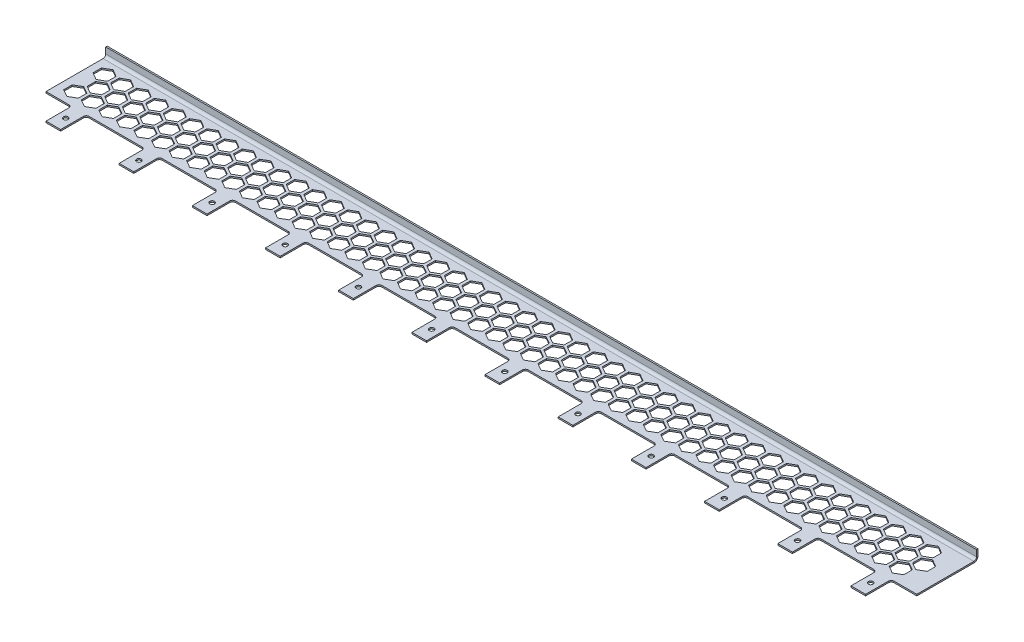
from build123d import *

# Parameters (mm, degrees)
SKETCH1_R          = 1.6
BASE_FLANGE2_DEPTH = 1
EDGE_FLANGE1_DEPTH = 595
CUT_EXTRUDE2_DEPTH = 597.496638716


# Sheet-metal steps are written as plain solids
with BuildPart() as part:
    # Sketch1 → Base-Flange2 (new body)
    with BuildSketch(Plane(origin=(0, 0, 0), x_dir=(1, 0, 0), z_dir=(0, 1, 0))):
        with BuildLine():
            Line((29.5, 0), (65.5, 0))
            ThreePointArc((65.5, 0), (66.914213562, -0.585786438), (67.5, -2))
            Line((67.5, -2), (67.5, -17.5))
            Line((67.5, -17.5), (77.5, -17.5))
            Line((77.5, -17.5), (77.5, -2))
            ThreePointArc((77.5, -2), (78.085786438, -0.585786438), (79.5, 0))
            Line((79.5, 0), (115.5, 0))
            ThreePointArc((115.5, 0), (116.914213562, -0.585786438), (117.5, -2))
            Line((117.5, -2), (117.5, -17.5))
            Line((117.5, -17.5), (127.5, -17.5))
            Line((127.5, -17.5), (127.5, -2))
            ThreePointArc((127.5, -2), (128.085786438, -0.585786438), (129.5, 0))
            Line((129.5, 0), (165.5, 0))
            ThreePointArc((165.5, 0), (166.914213562, -0.585786438), (167.5, -2))
            Line((167.5, -2), (167.5, -17.5))
            Line((167.5, -17.5), (177.5, -17.5))
            Line((177.5, -17.5), (177.5, -2))
            ThreePointArc((177.5, -2), (178.085786438, -0.585786438), (179.5, 0))
            Line((179.5, 0), (215.5, 0))
            ThreePointArc((215.5, 0), (216.914213562, -0.585786438), (217.5, -2))
            Line((217.5, -2), (217.5, -17.5))
            Line((217.5, -17.5), (227.5, -17.5))
            Line((227.5, -17.5), (227.5, -2))
            ThreePointArc((227.5, -2), (228.085786438, -0.585786438), (229.5, 0))
            Line((229.5, 0), (265.5, 0))
            ThreePointArc((265.5, 0), (266.914213562, -0.585786438), (267.5, -2))
            Line((267.5, -2), (267.5, -17.5))
            Line((267.5, -17.5), (277.5, -17.5))
            Line((277.5, -17.5), (277.5, -2))
            ThreePointArc((277.5, -2), (278.085786438, -0.585786438), (279.5, 0))
            Line((279.5, 0), (315.5, 0))
            ThreePointArc((315.5, 0), (316.914213562, -0.585786438), (317.5, -2))
            Line((317.5, -2), (317.5, -17.5))
            Line((317.5, -17.5), (327.5, -17.5))
            Line((327.5, -17.5), (327.5, -2))
            ThreePointArc((327.5, -2), (328.085786438, -0.585786438), (329.5, 0))
            Line((329.5, 0), (365.5, 0))
            ThreePointArc((365.5, 0), (366.914213562, -0.585786438), (367.5, -2))
            Line((367.5, -2), (367.5, -17.5))
            Line((367.5, -17.5), (377.5, -17.5))
            Line((377.5, -17.5), (377.5, -2))
            ThreePointArc((377.5, -2), (378.085786438, -0.585786438), (379.5, 0))
            Line((379.5, 0), (415.5, 0))
            ThreePointArc((415.5, 0), (416.914213562, -0.585786438), (417.5, -2))
            Line((417.5, -2), (417.5, -17.5))
            Line((417.5, -17.5), (427.5, -17.5))
            Line((427.5, -17.5), (427.5, -2))
            ThreePointArc((427.5, -2), (428.085786438, -0.585786438), (429.5, 0))
            Line((429.5, 0), (465.5, 0))
            ThreePointArc((465.5, 0), (466.914213562, -0.585786438), (467.5, -2))
            Line((467.5, -2), (467.5, -17.5))
            Line((467.5, -17.5), (477.5, -17.5))
            Line((477.5, -17.5), (477.5, -2))
            ThreePointArc((477.5, -2), (478.085786438, -0.585786438), (479.5, 0))
            Line((479.5, 0), (515.5, 0))
            ThreePointArc((515.5, 0), (516.914213562, -0.585786438), (517.5, -2))
            Line((517.5, -2), (517.5, -17.5))
            Line((517.5, -17.5), (527.5, -17.5))
            Line((527.5, -17.5), (527.5, -2))
            ThreePointArc((527.5, -2), (528.085786438, -0.585786438), (529.5, 0))
            Line((529.5, 0), (565.5, 0))
            ThreePointArc((565.5, 0), (566.914213562, -0.585786438), (567.5, -2))
            Line((567.5, -2), (567.5, -17.5))
            Line((567.5, -17.5), (577.5, -17.5))
            Line((577.5, -17.5), (577.5, -2))
            ThreePointArc((577.5, -2), (578.085786438, -0.585786438), (579.5, 0))
            Line((579.5, 0), (595, 0))
            Line((595, 0), (595, 39))
            Line((595, 39), (0, 39))
            Line((0, 39), (0, 0))
            Line((0, 0), (15.5, 0))
            ThreePointArc((15.5, 0), (16.914213562, -0.585786438), (17.5, -2))
            Line((17.5, -2), (17.5, -17.5))
            Line((17.5, -17.5), (27.5, -17.5))
            Line((27.5, -17.5), (27.5, -2))
            ThreePointArc((27.5, -2), (28.085786438, -0.585786438), (29.5, 0))
        make_face()
        with Locations(Location((22.5, -9, 0), (0, 0, 270))):
            Circle(SKETCH1_R, mode=Mode.SUBTRACT)
        with Locations(Location((72.5, -9, 0), (0, 0, 270))):
            Circle(SKETCH1_R, mode=Mode.SUBTRACT)
        with Locations(Location((122.5, -9, 0), (0, 0, 270))):
            Circle(SKETCH1_R, mode=Mode.SUBTRACT)
        with Locations(Location((172.5, -9, 0), (0, 0, 270))):
            Circle(SKETCH1_R, mode=Mode.SUBTRACT)
        with Locations(Location((222.5, -9, 0), (0, 0, 270))):
            Circle(SKETCH1_R, mode=Mode.SUBTRACT)
        with Locations(Location((272.5, -9, 0), (0, 0, 270))):
            Circle(SKETCH1_R, mode=Mode.SUBTRACT)
        with Locations(Location((322.5, -9, 0), (0, 0, 270))):
            Circle(SKETCH1_R, mode=Mode.SUBTRACT)
        with Locations(Location((372.5, -9, 0), (0, 0, 270))):
            Circle(SKETCH1_R, mode=Mode.SUBTRACT)
        with Locations(Location((422.5, -9, 0), (0, 0, 270))):
            Circle(SKETCH1_R, mode=Mode.SUBTRACT)
        with Locations(Location((472.5, -9, 0), (0, 0, 270))):
            Circle(SKETCH1_R, mode=Mode.SUBTRACT)
        with Locations(Location((522.5, -9, 0), (0, 0, 270))):
            Circle(SKETCH1_R, mode=Mode.SUBTRACT)
        with Locations(Location((572.5, -9, 0), (0, 0, 270))):
            Circle(SKETCH1_R, mode=Mode.SUBTRACT)
    extrude(amount=-BASE_FLANGE2_DEPTH)

    # Edge-Flange1 section (across the edge) → Edge-Flange1 (add)
    with BuildSketch(Plane(origin=(595, 0, -40.8), x_dir=(0, 0, 1), z_dir=(-1, 0, 0))):
        with BuildLine():
            Line((-1, 1.8), (-1, 6))
            Line((-1, 6), (0, 6))
            Line((0, 6), (0, 1.8))
            ThreePointArc((0, 1.8), (0.527207794, 0.527207794), (1.8, 0))
            Line((1.8, 0), (1.8, -1))
            ThreePointArc((1.8, -1), (-0.179898987, -0.179898987), (-1, 1.8))
        make_face()
    extrude(amount=EDGE_FLANGE1_DEPTH)

    # Sketch15 → Cut-Extrude2 (cut, through all)
    with BuildSketch(Plane(origin=(0, 0, 0), x_dir=(1, 0, 0), z_dir=(0, 1, 0))):
        Polygon((10, 4.226497308), (15, 7.113248654), (15, 12.886751346), (10, 15.773502692), (5, 12.886751346), (5, 7.113248654), align=None)
        Polygon((21.937540227, 24.226836356), (26.968531093, 27.059231853), (27.031100072, 32.832395496), (22.062678186, 35.773163644), (17.031687321, 32.940768147), (16.969118341, 27.167604504), align=None)
        Polygon((15.982330318, 14.226524347), (20.991141743, 17.09795978), (21.008811424, 22.871435433), (16.017669682, 25.773475653), (11.008858257, 22.90204022), (10.991188576, 17.128564567), align=None)
        Polygon((9.937540227, 24.226836356), (14.968531093, 27.059231853), (15.031100072, 32.832395496), (10.062678186, 35.773163644), (5.031687321, 32.940768147), (4.969118341, 27.167604504), align=None)
        Polygon((27.982330318, 14.226524347), (32.991141743, 17.09795978), (33.008811424, 22.871435433), (28.017669682, 25.773475653), (23.008858257, 22.90204022), (22.991188576, 17.128564567), align=None)
        Polygon((22, 4.226497308), (27, 7.113248654), (27, 12.886751346), (22, 15.773502692), (17, 12.886751346), (17, 7.113248654), align=None)
        Polygon((33.937540227, 24.226836356), (38.968531093, 27.059231853), (39.031100072, 32.832395496), (34.062678186, 35.773163644), (29.031687321, 32.940768147), (28.969118341, 27.167604504), align=None)
        Polygon((39.982330318, 14.226524347), (44.991141743, 17.09795978), (45.008811424, 22.871435433), (40.017669682, 25.773475653), (35.008858257, 22.90204022), (34.991188576, 17.128564567), align=None)
        Polygon((34, 4.226497308), (39, 7.113248654), (39, 12.886751346), (34, 15.773502692), (29, 12.886751346), (29, 7.113248654), align=None)
        Polygon((45.937540227, 24.226836356), (50.968531093, 27.059231853), (51.031100072, 32.832395496), (46.062678186, 35.773163644), (41.031687321, 32.940768147), (40.969118341, 27.167604504), align=None)
        Polygon((51.982330318, 14.226524347), (56.991141743, 17.09795978), (57.008811424, 22.871435433), (52.017669682, 25.773475653), (47.008858257, 22.90204022), (46.991188576, 17.128564567), align=None)
        Polygon((46, 4.226497308), (51, 7.113248654), (51, 12.886751346), (46, 15.773502692), (41, 12.886751346), (41, 7.113248654), align=None)
        Polygon((57.937540227, 24.226836356), (62.968531093, 27.059231853), (63.031100072, 32.832395496), (58.062678186, 35.773163644), (53.031687321, 32.940768147), (52.969118341, 27.167604504), align=None)
        Polygon((63.982330318, 14.226524347), (68.991141743, 17.09795978), (69.008811424, 22.871435433), (64.017669682, 25.773475653), (59.008858257, 22.90204022), (58.991188576, 17.128564567), align=None)
        Polygon((58, 4.226497308), (63, 7.113248654), (63, 12.886751346), (58, 15.773502692), (53, 12.886751346), (53, 7.113248654), align=None)
        Polygon((69.937540227, 24.226836356), (74.968531093, 27.059231853), (75.031100072, 32.832395496), (70.062678186, 35.773163644), (65.031687321, 32.940768147), (64.969118341, 27.167604504), align=None)
        Polygon((75.982330318, 14.226524347), (80.991141743, 17.09795978), (81.008811424, 22.871435433), (76.017669682, 25.773475653), (71.008858257, 22.90204022), (70.991188576, 17.128564567), align=None)
        Polygon((70, 4.226497308), (75, 7.113248654), (75, 12.886751346), (70, 15.773502692), (65, 12.886751346), (65, 7.113248654), align=None)
        Polygon((81.937540227, 24.226836356), (86.968531093, 27.059231853), (87.031100072, 32.832395496), (82.062678186, 35.773163644), (77.031687321, 32.940768147), (76.969118341, 27.167604504), align=None)
        Polygon((87.982330318, 14.226524347), (92.991141743, 17.09795978), (93.008811424, 22.871435433), (88.017669682, 25.773475653), (83.008858257, 22.90204022), (82.991188576, 17.128564567), align=None)
        Polygon((82, 4.226497308), (87, 7.113248654), (87, 12.886751346), (82, 15.773502692), (77, 12.886751346), (77, 7.113248654), align=None)
        Polygon((93.937540227, 24.226836356), (98.968531093, 27.059231853), (99.031100072, 32.832395496), (94.062678186, 35.773163644), (89.031687321, 32.940768147), (88.969118341, 27.167604504), align=None)
        Polygon((99.982330318, 14.226524347), (104.991141743, 17.09795978), (105.008811424, 22.871435433), (100.017669682, 25.773475653), (95.008858257, 22.90204022), (94.991188576, 17.128564567), align=None)
        Polygon((94, 4.226497308), (99, 7.113248654), (99, 12.886751346), (94, 15.773502692), (89, 12.886751346), (89, 7.113248654), align=None)
        Polygon((105.937540227, 24.226836356), (110.968531093, 27.059231853), (111.031100072, 32.832395496), (106.062678186, 35.773163644), (101.031687321, 32.940768147), (100.969118341, 27.167604504), align=None)
        Polygon((111.982330318, 14.226524347), (116.991141743, 17.09795978), (117.008811424, 22.871435433), (112.017669682, 25.773475653), (107.008858257, 22.90204022), (106.991188576, 17.128564567), align=None)
        Polygon((106, 4.226497308), (111, 7.113248654), (111, 12.886751346), (106, 15.773502692), (101, 12.886751346), (101, 7.113248654), align=None)
        Polygon((117.937540227, 24.226836356), (122.968531093, 27.059231853), (123.031100072, 32.832395496), (118.062678186, 35.773163644), (113.031687321, 32.940768147), (112.969118341, 27.167604504), align=None)
        Polygon((123.982330318, 14.226524347), (128.991141743, 17.09795978), (129.008811424, 22.871435433), (124.017669682, 25.773475653), (119.008858257, 22.90204022), (118.991188576, 17.128564567), align=None)
        Polygon((118, 4.226497308), (123, 7.113248654), (123, 12.886751346), (118, 15.773502692), (113, 12.886751346), (113, 7.113248654), align=None)
        Polygon((129.937540227, 24.226836356), (134.968531093, 27.059231853), (135.031100072, 32.832395496), (130.062678186, 35.773163644), (125.031687321, 32.940768147), (124.969118341, 27.167604504), align=None)
        Polygon((135.982330318, 14.226524347), (140.991141743, 17.09795978), (141.008811424, 22.871435433), (136.017669682, 25.773475653), (131.008858257, 22.90204022), (130.991188576, 17.128564567), align=None)
        Polygon((130, 4.226497308), (135, 7.113248654), (135, 12.886751346), (130, 15.773502692), (125, 12.886751346), (125, 7.113248654), align=None)
        Polygon((141.937540227, 24.226836356), (146.968531093, 27.059231853), (147.031100072, 32.832395496), (142.062678186, 35.773163644), (137.031687321, 32.940768147), (136.969118341, 27.167604504), align=None)
        Polygon((147.982330318, 14.226524347), (152.991141743, 17.09795978), (153.008811424, 22.871435433), (148.017669682, 25.773475653), (143.008858257, 22.90204022), (142.991188576, 17.128564567), align=None)
        Polygon((142, 4.226497308), (147, 7.113248654), (147, 12.886751346), (142, 15.773502692), (137, 12.886751346), (137, 7.113248654), align=None)
        Polygon((153.937540227, 24.226836356), (158.968531093, 27.059231853), (159.031100072, 32.832395496), (154.062678186, 35.773163644), (149.031687321, 32.940768147), (148.969118341, 27.167604504), align=None)
        Polygon((159.982330318, 14.226524347), (164.991141743, 17.09795978), (165.008811424, 22.871435433), (160.017669682, 25.773475653), (155.008858257, 22.90204022), (154.991188576, 17.128564567), align=None)
        Polygon((154, 4.226497308), (159, 7.113248654), (159, 12.886751346), (154, 15.773502692), (149, 12.886751346), (149, 7.113248654), align=None)
        Polygon((165.937540227, 24.226836356), (170.968531093, 27.059231853), (171.031100072, 32.832395496), (166.062678186, 35.773163644), (161.031687321, 32.940768147), (160.969118341, 27.167604504), align=None)
        Polygon((171.982330318, 14.226524347), (176.991141743, 17.09795978), (177.008811424, 22.871435433), (172.017669682, 25.773475653), (167.008858257, 22.90204022), (166.991188576, 17.128564567), align=None)
        Polygon((166, 4.226497308), (171, 7.113248654), (171, 12.886751346), (166, 15.773502692), (161, 12.886751346), (161, 7.113248654), align=None)
        Polygon((177.937540227, 24.226836356), (182.968531093, 27.059231853), (183.031100072, 32.832395496), (178.062678186, 35.773163644), (173.031687321, 32.940768147), (172.969118341, 27.167604504), align=None)
        Polygon((183.982330318, 14.226524347), (188.991141743, 17.09795978), (189.008811424, 22.871435433), (184.017669682, 25.773475653), (179.008858257, 22.90204022), (178.991188576, 17.128564567), align=None)
        Polygon((178, 4.226497308), (183, 7.113248654), (183, 12.886751346), (178, 15.773502692), (173, 12.886751346), (173, 7.113248654), align=None)
        Polygon((189.937540227, 24.226836356), (194.968531093, 27.059231853), (195.031100072, 32.832395496), (190.062678186, 35.773163644), (185.031687321, 32.940768147), (184.969118341, 27.167604504), align=None)
        Polygon((195.982330318, 14.226524347), (200.991141743, 17.09795978), (201.008811424, 22.871435433), (196.017669682, 25.773475653), (191.008858257, 22.90204022), (190.991188576, 17.128564567), align=None)
        Polygon((190, 4.226497308), (195, 7.113248654), (195, 12.886751346), (190, 15.773502692), (185, 12.886751346), (185, 7.113248654), align=None)
        Polygon((201.937540227, 24.226836356), (206.968531093, 27.059231853), (207.031100072, 32.832395496), (202.062678186, 35.773163644), (197.031687321, 32.940768147), (196.969118341, 27.167604504), align=None)
        Polygon((207.982330318, 14.226524347), (212.991141743, 17.09795978), (213.008811424, 22.871435433), (208.017669682, 25.773475653), (203.008858257, 22.90204022), (202.991188576, 17.128564567), align=None)
        Polygon((202, 4.226497308), (207, 7.113248654), (207, 12.886751346), (202, 15.773502692), (197, 12.886751346), (197, 7.113248654), align=None)
        Polygon((213.937540227, 24.226836356), (218.968531093, 27.059231853), (219.031100072, 32.832395496), (214.062678186, 35.773163644), (209.031687321, 32.940768147), (208.969118341, 27.167604504), align=None)
        Polygon((219.982330318, 14.226524347), (224.991141743, 17.09795978), (225.008811424, 22.871435433), (220.017669682, 25.773475653), (215.008858257, 22.90204022), (214.991188576, 17.128564567), align=None)
        Polygon((214, 4.226497308), (219, 7.113248654), (219, 12.886751346), (214, 15.773502692), (209, 12.886751346), (209, 7.113248654), align=None)
        Polygon((225.937540227, 24.226836356), (230.968531093, 27.059231853), (231.031100072, 32.832395496), (226.062678186, 35.773163644), (221.031687321, 32.940768147), (220.969118341, 27.167604504), align=None)
        Polygon((231.982330318, 14.226524347), (236.991141743, 17.09795978), (237.008811424, 22.871435433), (232.017669682, 25.773475653), (227.008858257, 22.90204022), (226.991188576, 17.128564567), align=None)
        Polygon((226, 4.226497308), (231, 7.113248654), (231, 12.886751346), (226, 15.773502692), (221, 12.886751346), (221, 7.113248654), align=None)
        Polygon((237.937540227, 24.226836356), (242.968531093, 27.059231853), (243.031100072, 32.832395496), (238.062678186, 35.773163644), (233.031687321, 32.940768147), (232.969118341, 27.167604504), align=None)
        Polygon((243.982330318, 14.226524347), (248.991141743, 17.09795978), (249.008811424, 22.871435433), (244.017669682, 25.773475653), (239.008858257, 22.90204022), (238.991188576, 17.128564567), align=None)
        Polygon((238, 4.226497308), (243, 7.113248654), (243, 12.886751346), (238, 15.773502692), (233, 12.886751346), (233, 7.113248654), align=None)
        Polygon((249.937540227, 24.226836356), (254.968531093, 27.059231853), (255.031100072, 32.832395496), (250.062678186, 35.773163644), (245.031687321, 32.940768147), (244.969118341, 27.167604504), align=None)
        Polygon((255.982330318, 14.226524347), (260.991141743, 17.09795978), (261.008811424, 22.871435433), (256.017669682, 25.773475653), (251.008858257, 22.90204022), (250.991188576, 17.128564567), align=None)
        Polygon((250, 4.226497308), (255, 7.113248654), (255, 12.886751346), (250, 15.773502692), (245, 12.886751346), (245, 7.113248654), align=None)
        Polygon((261.937540227, 24.226836356), (266.968531093, 27.059231853), (267.031100072, 32.832395496), (262.062678186, 35.773163644), (257.031687321, 32.940768147), (256.969118341, 27.167604504), align=None)
        Polygon((267.982330318, 14.226524347), (272.991141743, 17.09795978), (273.008811424, 22.871435433), (268.017669682, 25.773475653), (263.008858257, 22.90204022), (262.991188576, 17.128564567), align=None)
        Polygon((262, 4.226497308), (267, 7.113248654), (267, 12.886751346), (262, 15.773502692), (257, 12.886751346), (257, 7.113248654), align=None)
        Polygon((273.937540227, 24.226836356), (278.968531093, 27.059231853), (279.031100072, 32.832395496), (274.062678186, 35.773163644), (269.031687321, 32.940768147), (268.969118341, 27.167604504), align=None)
        Polygon((279.982330318, 14.226524347), (284.991141743, 17.09795978), (285.008811424, 22.871435433), (280.017669682, 25.773475653), (275.008858257, 22.90204022), (274.991188576, 17.128564567), align=None)
        Polygon((274, 4.226497308), (279, 7.113248654), (279, 12.886751346), (274, 15.773502692), (269, 12.886751346), (269, 7.113248654), align=None)
        Polygon((285.937540227, 24.226836356), (290.968531093, 27.059231853), (291.031100072, 32.832395496), (286.062678186, 35.773163644), (281.031687321, 32.940768147), (280.969118341, 27.167604504), align=None)
        Polygon((291.982330318, 14.226524347), (296.991141743, 17.09795978), (297.008811424, 22.871435433), (292.017669682, 25.773475653), (287.008858257, 22.90204022), (286.991188576, 17.128564567), align=None)
        Polygon((286, 4.226497308), (291, 7.113248654), (291, 12.886751346), (286, 15.773502692), (281, 12.886751346), (281, 7.113248654), align=None)
        Polygon((297.937540227, 24.226836356), (302.968531093, 27.059231853), (303.031100072, 32.832395496), (298.062678186, 35.773163644), (293.031687321, 32.940768147), (292.969118341, 27.167604504), align=None)
        Polygon((303.982330318, 14.226524347), (308.991141743, 17.09795978), (309.008811424, 22.871435433), (304.017669682, 25.773475653), (299.008858257, 22.90204022), (298.991188576, 17.128564567), align=None)
        Polygon((298, 4.226497308), (303, 7.113248654), (303, 12.886751346), (298, 15.773502692), (293, 12.886751346), (293, 7.113248654), align=None)
        Polygon((309.937540227, 24.226836356), (314.968531093, 27.059231853), (315.031100072, 32.832395496), (310.062678186, 35.773163644), (305.031687321, 32.940768147), (304.969118341, 27.167604504), align=None)
        Polygon((315.982330318, 14.226524347), (320.991141743, 17.09795978), (321.008811424, 22.871435433), (316.017669682, 25.773475653), (311.008858257, 22.90204022), (310.991188576, 17.128564567), align=None)
        Polygon((310, 4.226497308), (315, 7.113248654), (315, 12.886751346), (310, 15.773502692), (305, 12.886751346), (305, 7.113248654), align=None)
        Polygon((321.937540227, 24.226836356), (326.968531093, 27.059231853), (327.031100072, 32.832395496), (322.062678186, 35.773163644), (317.031687321, 32.940768147), (316.969118341, 27.167604504), align=None)
        Polygon((327.982330318, 14.226524347), (332.991141743, 17.09795978), (333.008811424, 22.871435433), (328.017669682, 25.773475653), (323.008858257, 22.90204022), (322.991188576, 17.128564567), align=None)
        Polygon((322, 4.226497308), (327, 7.113248654), (327, 12.886751346), (322, 15.773502692), (317, 12.886751346), (317, 7.113248654), align=None)
        Polygon((333.937540227, 24.226836356), (338.968531093, 27.059231853), (339.031100072, 32.832395496), (334.062678186, 35.773163644), (329.031687321, 32.940768147), (328.969118341, 27.167604504), align=None)
        Polygon((339.982330318, 14.226524347), (344.991141743, 17.09795978), (345.008811424, 22.871435433), (340.017669682, 25.773475653), (335.008858257, 22.90204022), (334.991188576, 17.128564567), align=None)
        Polygon((334, 4.226497308), (339, 7.113248654), (339, 12.886751346), (334, 15.773502692), (329, 12.886751346), (329, 7.113248654), align=None)
        Polygon((345.937540227, 24.226836356), (350.968531093, 27.059231853), (351.031100072, 32.832395496), (346.062678186, 35.773163644), (341.031687321, 32.940768147), (340.969118341, 27.167604504), align=None)
        Polygon((351.982330318, 14.226524347), (356.991141743, 17.09795978), (357.008811424, 22.871435433), (352.017669682, 25.773475653), (347.008858257, 22.90204022), (346.991188576, 17.128564567), align=None)
        Polygon((346, 4.226497308), (351, 7.113248654), (351, 12.886751346), (346, 15.773502692), (341, 12.886751346), (341, 7.113248654), align=None)
        Polygon((357.937540227, 24.226836356), (362.968531093, 27.059231853), (363.031100072, 32.832395496), (358.062678186, 35.773163644), (353.031687321, 32.940768147), (352.969118341, 27.167604504), align=None)
        Polygon((363.982330318, 14.226524347), (368.991141743, 17.09795978), (369.008811424, 22.871435433), (364.017669682, 25.773475653), (359.008858257, 22.90204022), (358.991188576, 17.128564567), align=None)
        Polygon((358, 4.226497308), (363, 7.113248654), (363, 12.886751346), (358, 15.773502692), (353, 12.886751346), (353, 7.113248654), align=None)
        Polygon((369.937540227, 24.226836356), (374.968531093, 27.059231853), (375.031100072, 32.832395496), (370.062678186, 35.773163644), (365.031687321, 32.940768147), (364.969118341, 27.167604504), align=None)
        Polygon((375.982330318, 14.226524347), (380.991141743, 17.09795978), (381.008811424, 22.871435433), (376.017669682, 25.773475653), (371.008858257, 22.90204022), (370.991188576, 17.128564567), align=None)
        Polygon((370, 4.226497308), (375, 7.113248654), (375, 12.886751346), (370, 15.773502692), (365, 12.886751346), (365, 7.113248654), align=None)
        Polygon((381.937540227, 24.226836356), (386.968531093, 27.059231853), (387.031100072, 32.832395496), (382.062678186, 35.773163644), (377.031687321, 32.940768147), (376.969118341, 27.167604504), align=None)
        Polygon((387.982330318, 14.226524347), (392.991141743, 17.09795978), (393.008811424, 22.871435433), (388.017669682, 25.773475653), (383.008858257, 22.90204022), (382.991188576, 17.128564567), align=None)
        Polygon((382, 4.226497308), (387, 7.113248654), (387, 12.886751346), (382, 15.773502692), (377, 12.886751346), (377, 7.113248654), align=None)
        Polygon((393.937540227, 24.226836356), (398.968531093, 27.059231853), (399.031100072, 32.832395496), (394.062678186, 35.773163644), (389.031687321, 32.940768147), (388.969118341, 27.167604504), align=None)
        Polygon((399.982330318, 14.226524347), (404.991141743, 17.09795978), (405.008811424, 22.871435433), (400.017669682, 25.773475653), (395.008858257, 22.90204022), (394.991188576, 17.128564567), align=None)
        Polygon((394, 4.226497308), (399, 7.113248654), (399, 12.886751346), (394, 15.773502692), (389, 12.886751346), (389, 7.113248654), align=None)
        Polygon((405.937540227, 24.226836356), (410.968531093, 27.059231853), (411.031100072, 32.832395496), (406.062678186, 35.773163644), (401.031687321, 32.940768147), (400.969118341, 27.167604504), align=None)
        Polygon((411.982330318, 14.226524347), (416.991141743, 17.09795978), (417.008811424, 22.871435433), (412.017669682, 25.773475653), (407.008858257, 22.90204022), (406.991188576, 17.128564567), align=None)
        Polygon((406, 4.226497308), (411, 7.113248654), (411, 12.886751346), (406, 15.773502692), (401, 12.886751346), (401, 7.113248654), align=None)
        Polygon((417.937540227, 24.226836356), (422.968531093, 27.059231853), (423.031100072, 32.832395496), (418.062678186, 35.773163644), (413.031687321, 32.940768147), (412.969118341, 27.167604504), align=None)
        Polygon((423.982330318, 14.226524347), (428.991141743, 17.09795978), (429.008811424, 22.871435433), (424.017669682, 25.773475653), (419.008858257, 22.90204022), (418.991188576, 17.128564567), align=None)
        Polygon((418, 4.226497308), (423, 7.113248654), (423, 12.886751346), (418, 15.773502692), (413, 12.886751346), (413, 7.113248654), align=None)
        Polygon((429.937540227, 24.226836356), (434.968531093, 27.059231853), (435.031100072, 32.832395496), (430.062678186, 35.773163644), (425.031687321, 32.940768147), (424.969118341, 27.167604504), align=None)
        Polygon((435.982330318, 14.226524347), (440.991141743, 17.09795978), (441.008811424, 22.871435433), (436.017669682, 25.773475653), (431.008858257, 22.90204022), (430.991188576, 17.128564567), align=None)
        Polygon((430, 4.226497308), (435, 7.113248654), (435, 12.886751346), (430, 15.773502692), (425, 12.886751346), (425, 7.113248654), align=None)
        Polygon((441.937540227, 24.226836356), (446.968531093, 27.059231853), (447.031100072, 32.832395496), (442.062678186, 35.773163644), (437.031687321, 32.940768147), (436.969118341, 27.167604504), align=None)
        Polygon((447.982330318, 14.226524347), (452.991141743, 17.09795978), (453.008811424, 22.871435433), (448.017669682, 25.773475653), (443.008858257, 22.90204022), (442.991188576, 17.128564567), align=None)
        Polygon((442, 4.226497308), (447, 7.113248654), (447, 12.886751346), (442, 15.773502692), (437, 12.886751346), (437, 7.113248654), align=None)
        Polygon((453.937540227, 24.226836356), (458.968531093, 27.059231853), (459.031100072, 32.832395496), (454.062678186, 35.773163644), (449.031687321, 32.940768147), (448.969118341, 27.167604504), align=None)
        Polygon((459.982330318, 14.226524347), (464.991141743, 17.09795978), (465.008811424, 22.871435433), (460.017669682, 25.773475653), (455.008858257, 22.90204022), (454.991188576, 17.128564567), align=None)
        Polygon((454, 4.226497308), (459, 7.113248654), (459, 12.886751346), (454, 15.773502692), (449, 12.886751346), (449, 7.113248654), align=None)
        Polygon((465.937540227, 24.226836356), (470.968531093, 27.059231853), (471.031100072, 32.832395496), (466.062678186, 35.773163644), (461.031687321, 32.940768147), (460.969118341, 27.167604504), align=None)
        Polygon((471.982330318, 14.226524347), (476.991141743, 17.09795978), (477.008811424, 22.871435433), (472.017669682, 25.773475653), (467.008858257, 22.90204022), (466.991188576, 17.128564567), align=None)
        Polygon((466, 4.226497308), (471, 7.113248654), (471, 12.886751346), (466, 15.773502692), (461, 12.886751346), (461, 7.113248654), align=None)
        Polygon((477.937540227, 24.226836356), (482.968531093, 27.059231853), (483.031100072, 32.832395496), (478.062678186, 35.773163644), (473.031687321, 32.940768147), (472.969118341, 27.167604504), align=None)
        Polygon((483.982330318, 14.226524347), (488.991141743, 17.09795978), (489.008811424, 22.871435433), (484.017669682, 25.773475653), (479.008858257, 22.90204022), (478.991188576, 17.128564567), align=None)
        Polygon((478, 4.226497308), (483, 7.113248654), (483, 12.886751346), (478, 15.773502692), (473, 12.886751346), (473, 7.113248654), align=None)
        Polygon((489.937540227, 24.226836356), (494.968531093, 27.059231853), (495.031100072, 32.832395496), (490.062678186, 35.773163644), (485.031687321, 32.940768147), (484.969118341, 27.167604504), align=None)
        Polygon((495.982330318, 14.226524347), (500.991141743, 17.09795978), (501.008811424, 22.871435433), (496.017669682, 25.773475653), (491.008858257, 22.90204022), (490.991188576, 17.128564567), align=None)
        Polygon((490, 4.226497308), (495, 7.113248654), (495, 12.886751346), (490, 15.773502692), (485, 12.886751346), (485, 7.113248654), align=None)
        Polygon((501.937540227, 24.226836356), (506.968531093, 27.059231853), (507.031100072, 32.832395496), (502.062678186, 35.773163644), (497.031687321, 32.940768147), (496.969118341, 27.167604504), align=None)
        Polygon((507.982330318, 14.226524347), (512.991141743, 17.09795978), (513.008811424, 22.871435433), (508.017669682, 25.773475653), (503.008858257, 22.90204022), (502.991188576, 17.128564567), align=None)
        Polygon((502, 4.226497308), (507, 7.113248654), (507, 12.886751346), (502, 15.773502692), (497, 12.886751346), (497, 7.113248654), align=None)
        Polygon((513.937540227, 24.226836356), (518.968531093, 27.059231853), (519.031100072, 32.832395496), (514.062678186, 35.773163644), (509.031687321, 32.940768147), (508.969118341, 27.167604504), align=None)
        Polygon((519.982330318, 14.226524347), (524.991141743, 17.09795978), (525.008811424, 22.871435433), (520.017669682, 25.773475653), (515.008858257, 22.90204022), (514.991188576, 17.128564567), align=None)
        Polygon((514, 4.226497308), (519, 7.113248654), (519, 12.886751346), (514, 15.773502692), (509, 12.886751346), (509, 7.113248654), align=None)
        Polygon((525.937540227, 24.226836356), (530.968531093, 27.059231853), (531.031100072, 32.832395496), (526.062678186, 35.773163644), (521.031687321, 32.940768147), (520.969118341, 27.167604504), align=None)
        Polygon((531.982330318, 14.226524347), (536.991141743, 17.09795978), (537.008811424, 22.871435433), (532.017669682, 25.773475653), (527.008858257, 22.90204022), (526.991188576, 17.128564567), align=None)
        Polygon((526, 4.226497308), (531, 7.113248654), (531, 12.886751346), (526, 15.773502692), (521, 12.886751346), (521, 7.113248654), align=None)
        Polygon((537.937540227, 24.226836356), (542.968531093, 27.059231853), (543.031100072, 32.832395496), (538.062678186, 35.773163644), (533.031687321, 32.940768147), (532.969118341, 27.167604504), align=None)
        Polygon((543.982330318, 14.226524347), (548.991141743, 17.09795978), (549.008811424, 22.871435433), (544.017669682, 25.773475653), (539.008858257, 22.90204022), (538.991188576, 17.128564567), align=None)
        Polygon((538, 4.226497308), (543, 7.113248654), (543, 12.886751346), (538, 15.773502692), (533, 12.886751346), (533, 7.113248654), align=None)
        Polygon((549.937540227, 24.226836356), (554.968531093, 27.059231853), (555.031100072, 32.832395496), (550.062678186, 35.773163644), (545.031687321, 32.940768147), (544.969118341, 27.167604504), align=None)
        Polygon((555.982330318, 14.226524347), (560.991141743, 17.09795978), (561.008811424, 22.871435433), (556.017669682, 25.773475653), (551.008858257, 22.90204022), (550.991188576, 17.128564567), align=None)
        Polygon((550, 4.226497308), (555, 7.113248654), (555, 12.886751346), (550, 15.773502692), (545, 12.886751346), (545, 7.113248654), align=None)
        Polygon((561.937540227, 24.226836356), (566.968531093, 27.059231853), (567.031100072, 32.832395496), (562.062678186, 35.773163644), (557.031687321, 32.940768147), (556.969118341, 27.167604504), align=None)
        Polygon((567.982330318, 14.226524347), (572.991141743, 17.09795978), (573.008811424, 22.871435433), (568.017669682, 25.773475653), (563.008858257, 22.90204022), (562.991188576, 17.128564567), align=None)
        Polygon((562, 4.226497308), (567, 7.113248654), (567, 12.886751346), (562, 15.773502692), (557, 12.886751346), (557, 7.113248654), align=None)
        Polygon((573.937540227, 24.226836356), (578.968531093, 27.059231853), (579.031100072, 32.832395496), (574.062678186, 35.773163644), (569.031687321, 32.940768147), (568.969118341, 27.167604504), align=None)
        Polygon((579.982330318, 14.226524347), (584.991141743, 17.09795978), (585.008811424, 22.871435433), (580.017669682, 25.773475653), (575.008858257, 22.90204022), (574.991188576, 17.128564567), align=None)
        Polygon((574, 4.226497308), (579, 7.113248654), (579, 12.886751346), (574, 15.773502692), (569, 12.886751346), (569, 7.113248654), align=None)
    extrude(amount=-CUT_EXTRUDE2_DEPTH, mode=Mode.SUBTRACT)


solid = part.part
